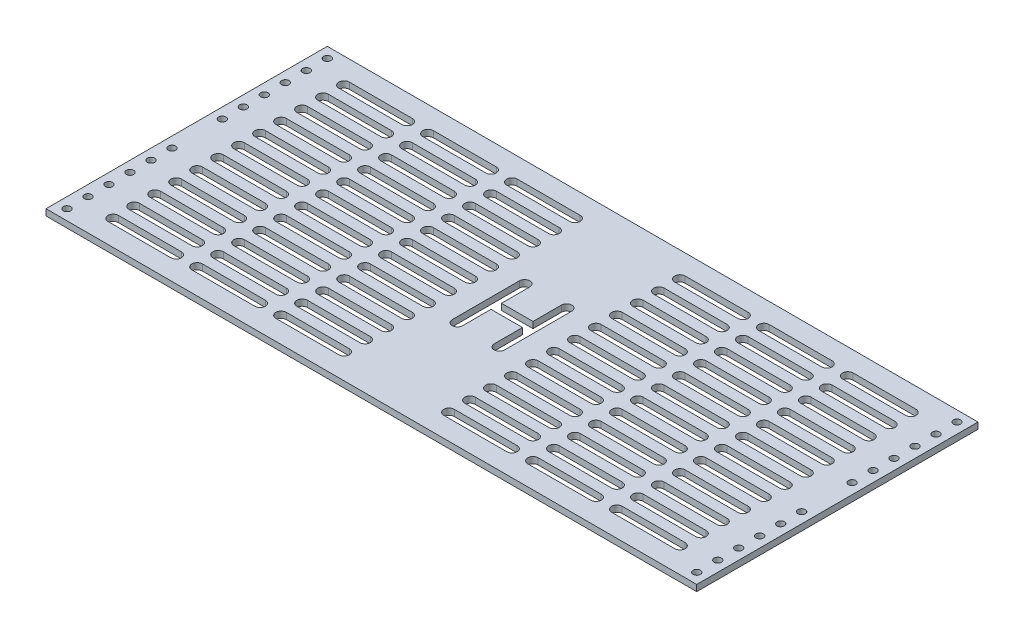
from build123d import *

# Parameters (mm, degrees)
EXTRUDE_1_DEPTH          = 3
CUT_EXTRUDE_5_DEPTH      = 10
CUT_EXTRUDE_2_DEPTH      = 205.914616365
MIRROR_2_COPY_1_DEPTH    = 205.914616365
MIRROR_2_COPY_2_DEPTH    = 205.914616365
SKETCH_4_R               = 1.75
CUT_EXTRUDE_3_DEPTH      = 205.914616365
MIRROR_4_COPY_1_SKETCH_R = 1.75
MIRROR_4_COPY_1_DEPTH    = 205.914616365
MIRROR_4_COPY_2_SKETCH_R = 1.75
MIRROR_4_COPY_2_DEPTH    = 205.914616365


with BuildPart() as part:
    # 草图1 → 凸台-拉伸1 (new body)
    with BuildSketch(Plane(origin=(0, 0, 0), x_dir=(1, 0, 0), z_dir=(0, 1, 0))):
        Polygon((0, 0), (-155, 0), (-155, -134), (155, -134), (155, 0), align=None)
    extrude(amount=EXTRUDE_1_DEPTH)

    # 草图2 → 切除-拉伸5 (cut)
    with BuildSketch(Plane(origin=(0, 3, 0), x_dir=(1, 0, 0), z_dir=(0, 1, 0))):
        with BuildLine():
            Line((7.5, -64.5), (-7.5, -64.5))
            Line((-7.5, -64.5), (-7.5, -51))
            ThreePointArc((-7.5, -51), (-10, -48.5), (-12.5, -51))
            Line((-12.5, -51), (-12.5, -83))
            ThreePointArc((-12.5, -83), (-10, -85.5), (-7.5, -83))
            Line((-7.5, -83), (-7.5, -69.5))
            Line((-7.5, -69.5), (7.5, -69.5))
            Line((7.5, -69.5), (7.5, -83))
            ThreePointArc((7.5, -83), (10, -85.5), (12.5, -83))
            Line((12.5, -83), (12.5, -51))
            ThreePointArc((12.5, -51), (10, -48.5), (7.5, -51))
            Line((7.5, -51), (7.5, -64.5))
        make_face()
    extrude(amount=-CUT_EXTRUDE_5_DEPTH, mode=Mode.SUBTRACT)

    # 草图3 → 切除-拉伸2 (cut, through all)
    with BuildSketch(Plane(origin=(0, 3, 0), x_dir=(1, 0, 0), z_dir=(0, 1, 0))):
        with BuildLine():
            ThreePointArc((-135, -119.5), (-137.5, -122), (-135, -124.5))
            Line((-135, -124.5), (-105, -124.5))
            ThreePointArc((-105, -124.5), (-102.5, -122), (-105, -119.5))
            Line((-105, -119.5), (-135, -119.5))
        make_face()
        with BuildLine():
            ThreePointArc((-55, -119.5), (-57.5, -122), (-55, -124.5))
            Line((-55, -124.5), (-25, -124.5))
            ThreePointArc((-25, -124.5), (-22.5, -122), (-25, -119.5))
            Line((-25, -119.5), (-55, -119.5))
        make_face()
        with BuildLine():
            ThreePointArc((-95, -119.5), (-97.5, -122), (-95, -124.5))
            Line((-95, -124.5), (-65, -124.5))
            ThreePointArc((-65, -124.5), (-62.5, -122), (-65, -119.5))
            Line((-65, -119.5), (-95, -119.5))
        make_face()
        with BuildLine():
            ThreePointArc((-135, -109.5), (-137.5, -112), (-135, -114.5))
            Line((-135, -114.5), (-105, -114.5))
            ThreePointArc((-105, -114.5), (-102.5, -112), (-105, -109.5))
            Line((-105, -109.5), (-135, -109.5))
        make_face()
        with BuildLine():
            ThreePointArc((-95, -109.5), (-97.5, -112), (-95, -114.5))
            Line((-95, -114.5), (-65, -114.5))
            ThreePointArc((-65, -114.5), (-62.5, -112), (-65, -109.5))
            Line((-65, -109.5), (-95, -109.5))
        make_face()
        with BuildLine():
            ThreePointArc((-55, -109.5), (-57.5, -112), (-55, -114.5))
            Line((-55, -114.5), (-25, -114.5))
            ThreePointArc((-25, -114.5), (-22.5, -112), (-25, -109.5))
            Line((-25, -109.5), (-55, -109.5))
        make_face()
        with BuildLine():
            ThreePointArc((-135, -99.5), (-137.5, -102), (-135, -104.5))
            Line((-135, -104.5), (-105, -104.5))
            ThreePointArc((-105, -104.5), (-102.5, -102), (-105, -99.5))
            Line((-105, -99.5), (-135, -99.5))
        make_face()
        with BuildLine():
            ThreePointArc((-95, -99.5), (-97.5, -102), (-95, -104.5))
            Line((-95, -104.5), (-65, -104.5))
            ThreePointArc((-65, -104.5), (-62.5, -102), (-65, -99.5))
            Line((-65, -99.5), (-95, -99.5))
        make_face()
        with BuildLine():
            ThreePointArc((-55, -99.5), (-57.5, -102), (-55, -104.5))
            Line((-55, -104.5), (-25, -104.5))
            ThreePointArc((-25, -104.5), (-22.5, -102), (-25, -99.5))
            Line((-25, -99.5), (-55, -99.5))
        make_face()
        with BuildLine():
            ThreePointArc((-135, -89.5), (-137.5, -92), (-135, -94.5))
            Line((-135, -94.5), (-105, -94.5))
            ThreePointArc((-105, -94.5), (-102.5, -92), (-105, -89.5))
            Line((-105, -89.5), (-135, -89.5))
        make_face()
        with BuildLine():
            ThreePointArc((-95, -89.5), (-97.5, -92), (-95, -94.5))
            Line((-95, -94.5), (-65, -94.5))
            ThreePointArc((-65, -94.5), (-62.5, -92), (-65, -89.5))
            Line((-65, -89.5), (-95, -89.5))
        make_face()
        with BuildLine():
            ThreePointArc((-55, -89.5), (-57.5, -92), (-55, -94.5))
            Line((-55, -94.5), (-25, -94.5))
            ThreePointArc((-25, -94.5), (-22.5, -92), (-25, -89.5))
            Line((-25, -89.5), (-55, -89.5))
        make_face()
        with BuildLine():
            ThreePointArc((-135, -79.5), (-137.5, -82), (-135, -84.5))
            Line((-135, -84.5), (-105, -84.5))
            ThreePointArc((-105, -84.5), (-102.5, -82), (-105, -79.5))
            Line((-105, -79.5), (-135, -79.5))
        make_face()
        with BuildLine():
            ThreePointArc((-95, -79.5), (-97.5, -82), (-95, -84.5))
            Line((-95, -84.5), (-65, -84.5))
            ThreePointArc((-65, -84.5), (-62.5, -82), (-65, -79.5))
            Line((-65, -79.5), (-95, -79.5))
        make_face()
        with BuildLine():
            ThreePointArc((-55, -79.5), (-57.5, -82), (-55, -84.5))
            Line((-55, -84.5), (-25, -84.5))
            ThreePointArc((-25, -84.5), (-22.5, -82), (-25, -79.5))
            Line((-25, -79.5), (-55, -79.5))
        make_face()
        with BuildLine():
            ThreePointArc((-135, -69.5), (-137.5, -72), (-135, -74.5))
            Line((-135, -74.5), (-105, -74.5))
            ThreePointArc((-105, -74.5), (-102.5, -72), (-105, -69.5))
            Line((-105, -69.5), (-135, -69.5))
        make_face()
        with BuildLine():
            ThreePointArc((-95, -69.5), (-97.5, -72), (-95, -74.5))
            Line((-95, -74.5), (-65, -74.5))
            ThreePointArc((-65, -74.5), (-62.5, -72), (-65, -69.5))
            Line((-65, -69.5), (-95, -69.5))
        make_face()
        with BuildLine():
            ThreePointArc((-55, -69.5), (-57.5, -72), (-55, -74.5))
            Line((-55, -74.5), (-25, -74.5))
            ThreePointArc((-25, -74.5), (-22.5, -72), (-25, -69.5))
            Line((-25, -69.5), (-55, -69.5))
        make_face()
    cut_extrude_2 = extrude(amount=-CUT_EXTRUDE_2_DEPTH, mode=Mode.SUBTRACT)

    # 镜向1: 切除-拉伸2 across plane
    add(cut_extrude_2.mirror(Plane.XY.offset(67)), mode=Mode.SUBTRACT)

    # 镜向2 copy 1 sketch → 镜向2 copy 1 (cut, through all)
    with BuildSketch(Plane(origin=(0, 3, 134), x_dir=(-1, 0, 0), z_dir=(0, 1, 0))):
        with BuildLine():
            ThreePointArc((-135, -119.5), (-137.5, -122), (-135, -124.5))
            Line((-135, -124.5), (-105, -124.5))
            ThreePointArc((-105, -124.5), (-102.5, -122), (-105, -119.5))
            Line((-105, -119.5), (-135, -119.5))
        make_face()
        with BuildLine():
            ThreePointArc((-55, -119.5), (-57.5, -122), (-55, -124.5))
            Line((-55, -124.5), (-25, -124.5))
            ThreePointArc((-25, -124.5), (-22.5, -122), (-25, -119.5))
            Line((-25, -119.5), (-55, -119.5))
        make_face()
        with BuildLine():
            ThreePointArc((-95, -119.5), (-97.5, -122), (-95, -124.5))
            Line((-95, -124.5), (-65, -124.5))
            ThreePointArc((-65, -124.5), (-62.5, -122), (-65, -119.5))
            Line((-65, -119.5), (-95, -119.5))
        make_face()
        with BuildLine():
            ThreePointArc((-135, -109.5), (-137.5, -112), (-135, -114.5))
            Line((-135, -114.5), (-105, -114.5))
            ThreePointArc((-105, -114.5), (-102.5, -112), (-105, -109.5))
            Line((-105, -109.5), (-135, -109.5))
        make_face()
        with BuildLine():
            ThreePointArc((-95, -109.5), (-97.5, -112), (-95, -114.5))
            Line((-95, -114.5), (-65, -114.5))
            ThreePointArc((-65, -114.5), (-62.5, -112), (-65, -109.5))
            Line((-65, -109.5), (-95, -109.5))
        make_face()
        with BuildLine():
            ThreePointArc((-55, -109.5), (-57.5, -112), (-55, -114.5))
            Line((-55, -114.5), (-25, -114.5))
            ThreePointArc((-25, -114.5), (-22.5, -112), (-25, -109.5))
            Line((-25, -109.5), (-55, -109.5))
        make_face()
        with BuildLine():
            ThreePointArc((-135, -99.5), (-137.5, -102), (-135, -104.5))
            Line((-135, -104.5), (-105, -104.5))
            ThreePointArc((-105, -104.5), (-102.5, -102), (-105, -99.5))
            Line((-105, -99.5), (-135, -99.5))
        make_face()
        with BuildLine():
            ThreePointArc((-95, -99.5), (-97.5, -102), (-95, -104.5))
            Line((-95, -104.5), (-65, -104.5))
            ThreePointArc((-65, -104.5), (-62.5, -102), (-65, -99.5))
            Line((-65, -99.5), (-95, -99.5))
        make_face()
        with BuildLine():
            ThreePointArc((-55, -99.5), (-57.5, -102), (-55, -104.5))
            Line((-55, -104.5), (-25, -104.5))
            ThreePointArc((-25, -104.5), (-22.5, -102), (-25, -99.5))
            Line((-25, -99.5), (-55, -99.5))
        make_face()
        with BuildLine():
            ThreePointArc((-135, -89.5), (-137.5, -92), (-135, -94.5))
            Line((-135, -94.5), (-105, -94.5))
            ThreePointArc((-105, -94.5), (-102.5, -92), (-105, -89.5))
            Line((-105, -89.5), (-135, -89.5))
        make_face()
        with BuildLine():
            ThreePointArc((-95, -89.5), (-97.5, -92), (-95, -94.5))
            Line((-95, -94.5), (-65, -94.5))
            ThreePointArc((-65, -94.5), (-62.5, -92), (-65, -89.5))
            Line((-65, -89.5), (-95, -89.5))
        make_face()
        with BuildLine():
            ThreePointArc((-55, -89.5), (-57.5, -92), (-55, -94.5))
            Line((-55, -94.5), (-25, -94.5))
            ThreePointArc((-25, -94.5), (-22.5, -92), (-25, -89.5))
            Line((-25, -89.5), (-55, -89.5))
        make_face()
        with BuildLine():
            ThreePointArc((-135, -79.5), (-137.5, -82), (-135, -84.5))
            Line((-135, -84.5), (-105, -84.5))
            ThreePointArc((-105, -84.5), (-102.5, -82), (-105, -79.5))
            Line((-105, -79.5), (-135, -79.5))
        make_face()
        with BuildLine():
            ThreePointArc((-95, -79.5), (-97.5, -82), (-95, -84.5))
            Line((-95, -84.5), (-65, -84.5))
            ThreePointArc((-65, -84.5), (-62.5, -82), (-65, -79.5))
            Line((-65, -79.5), (-95, -79.5))
        make_face()
        with BuildLine():
            ThreePointArc((-55, -79.5), (-57.5, -82), (-55, -84.5))
            Line((-55, -84.5), (-25, -84.5))
            ThreePointArc((-25, -84.5), (-22.5, -82), (-25, -79.5))
            Line((-25, -79.5), (-55, -79.5))
        make_face()
        with BuildLine():
            ThreePointArc((-135, -69.5), (-137.5, -72), (-135, -74.5))
            Line((-135, -74.5), (-105, -74.5))
            ThreePointArc((-105, -74.5), (-102.5, -72), (-105, -69.5))
            Line((-105, -69.5), (-135, -69.5))
        make_face()
        with BuildLine():
            ThreePointArc((-95, -69.5), (-97.5, -72), (-95, -74.5))
            Line((-95, -74.5), (-65, -74.5))
            ThreePointArc((-65, -74.5), (-62.5, -72), (-65, -69.5))
            Line((-65, -69.5), (-95, -69.5))
        make_face()
        with BuildLine():
            ThreePointArc((-55, -69.5), (-57.5, -72), (-55, -74.5))
            Line((-55, -74.5), (-25, -74.5))
            ThreePointArc((-25, -74.5), (-22.5, -72), (-25, -69.5))
            Line((-25, -69.5), (-55, -69.5))
        make_face()
    extrude(amount=-MIRROR_2_COPY_1_DEPTH, mode=Mode.SUBTRACT)

    # 镜向2 copy 2 sketch → 镜向2 copy 2 (cut, through all)
    with BuildSketch(Plane(origin=(0, 3, 0), x_dir=(-1, 0, 0), z_dir=(0, 1, 0))):
        with BuildLine():
            ThreePointArc((-135, 119.5), (-137.5, 122), (-135, 124.5))
            Line((-135, 124.5), (-105, 124.5))
            ThreePointArc((-105, 124.5), (-102.5, 122), (-105, 119.5))
            Line((-105, 119.5), (-135, 119.5))
        make_face()
        with BuildLine():
            ThreePointArc((-55, 119.5), (-57.5, 122), (-55, 124.5))
            Line((-55, 124.5), (-25, 124.5))
            ThreePointArc((-25, 124.5), (-22.5, 122), (-25, 119.5))
            Line((-25, 119.5), (-55, 119.5))
        make_face()
        with BuildLine():
            ThreePointArc((-95, 119.5), (-97.5, 122), (-95, 124.5))
            Line((-95, 124.5), (-65, 124.5))
            ThreePointArc((-65, 124.5), (-62.5, 122), (-65, 119.5))
            Line((-65, 119.5), (-95, 119.5))
        make_face()
        with BuildLine():
            ThreePointArc((-135, 109.5), (-137.5, 112), (-135, 114.5))
            Line((-135, 114.5), (-105, 114.5))
            ThreePointArc((-105, 114.5), (-102.5, 112), (-105, 109.5))
            Line((-105, 109.5), (-135, 109.5))
        make_face()
        with BuildLine():
            ThreePointArc((-95, 109.5), (-97.5, 112), (-95, 114.5))
            Line((-95, 114.5), (-65, 114.5))
            ThreePointArc((-65, 114.5), (-62.5, 112), (-65, 109.5))
            Line((-65, 109.5), (-95, 109.5))
        make_face()
        with BuildLine():
            ThreePointArc((-55, 109.5), (-57.5, 112), (-55, 114.5))
            Line((-55, 114.5), (-25, 114.5))
            ThreePointArc((-25, 114.5), (-22.5, 112), (-25, 109.5))
            Line((-25, 109.5), (-55, 109.5))
        make_face()
        with BuildLine():
            ThreePointArc((-135, 99.5), (-137.5, 102), (-135, 104.5))
            Line((-135, 104.5), (-105, 104.5))
            ThreePointArc((-105, 104.5), (-102.5, 102), (-105, 99.5))
            Line((-105, 99.5), (-135, 99.5))
        make_face()
        with BuildLine():
            ThreePointArc((-95, 99.5), (-97.5, 102), (-95, 104.5))
            Line((-95, 104.5), (-65, 104.5))
            ThreePointArc((-65, 104.5), (-62.5, 102), (-65, 99.5))
            Line((-65, 99.5), (-95, 99.5))
        make_face()
        with BuildLine():
            ThreePointArc((-55, 99.5), (-57.5, 102), (-55, 104.5))
            Line((-55, 104.5), (-25, 104.5))
            ThreePointArc((-25, 104.5), (-22.5, 102), (-25, 99.5))
            Line((-25, 99.5), (-55, 99.5))
        make_face()
        with BuildLine():
            ThreePointArc((-135, 89.5), (-137.5, 92), (-135, 94.5))
            Line((-135, 94.5), (-105, 94.5))
            ThreePointArc((-105, 94.5), (-102.5, 92), (-105, 89.5))
            Line((-105, 89.5), (-135, 89.5))
        make_face()
        with BuildLine():
            ThreePointArc((-95, 89.5), (-97.5, 92), (-95, 94.5))
            Line((-95, 94.5), (-65, 94.5))
            ThreePointArc((-65, 94.5), (-62.5, 92), (-65, 89.5))
            Line((-65, 89.5), (-95, 89.5))
        make_face()
        with BuildLine():
            ThreePointArc((-55, 89.5), (-57.5, 92), (-55, 94.5))
            Line((-55, 94.5), (-25, 94.5))
            ThreePointArc((-25, 94.5), (-22.5, 92), (-25, 89.5))
            Line((-25, 89.5), (-55, 89.5))
        make_face()
        with BuildLine():
            ThreePointArc((-135, 79.5), (-137.5, 82), (-135, 84.5))
            Line((-135, 84.5), (-105, 84.5))
            ThreePointArc((-105, 84.5), (-102.5, 82), (-105, 79.5))
            Line((-105, 79.5), (-135, 79.5))
        make_face()
        with BuildLine():
            ThreePointArc((-95, 79.5), (-97.5, 82), (-95, 84.5))
            Line((-95, 84.5), (-65, 84.5))
            ThreePointArc((-65, 84.5), (-62.5, 82), (-65, 79.5))
            Line((-65, 79.5), (-95, 79.5))
        make_face()
        with BuildLine():
            ThreePointArc((-55, 79.5), (-57.5, 82), (-55, 84.5))
            Line((-55, 84.5), (-25, 84.5))
            ThreePointArc((-25, 84.5), (-22.5, 82), (-25, 79.5))
            Line((-25, 79.5), (-55, 79.5))
        make_face()
        with BuildLine():
            ThreePointArc((-135, 69.5), (-137.5, 72), (-135, 74.5))
            Line((-135, 74.5), (-105, 74.5))
            ThreePointArc((-105, 74.5), (-102.5, 72), (-105, 69.5))
            Line((-105, 69.5), (-135, 69.5))
        make_face()
        with BuildLine():
            ThreePointArc((-95, 69.5), (-97.5, 72), (-95, 74.5))
            Line((-95, 74.5), (-65, 74.5))
            ThreePointArc((-65, 74.5), (-62.5, 72), (-65, 69.5))
            Line((-65, 69.5), (-95, 69.5))
        make_face()
        with BuildLine():
            ThreePointArc((-55, 69.5), (-57.5, 72), (-55, 74.5))
            Line((-55, 74.5), (-25, 74.5))
            ThreePointArc((-25, 74.5), (-22.5, 72), (-25, 69.5))
            Line((-25, 69.5), (-55, 69.5))
        make_face()
    extrude(amount=-MIRROR_2_COPY_2_DEPTH, mode=Mode.SUBTRACT)

    # 草图4 → 切除-拉伸3 (cut, through all)
    with BuildSketch(Plane(origin=(0, 3, 0), x_dir=(1, 0, 0), z_dir=(0, 1, 0))):
        with Locations((-150, -129)):
            Circle(SKETCH_4_R)
        with Locations((-150, -119)):
            Circle(SKETCH_4_R)
        with Locations((-150, -109)):
            Circle(SKETCH_4_R)
        with Locations((-150, -99)):
            Circle(SKETCH_4_R)
        with Locations((-150, -89)):
            Circle(SKETCH_4_R)
        with Locations((-150, -79)):
            Circle(SKETCH_4_R)
    cut_extrude_3 = extrude(amount=-CUT_EXTRUDE_3_DEPTH, mode=Mode.SUBTRACT)

    # 镜向3: 切除-拉伸3 across plane
    add(cut_extrude_3.mirror(Plane.XY.offset(67)), mode=Mode.SUBTRACT)

    # 镜向4 copy 1 sketch → 镜向4 copy 1 (cut, through all)
    with BuildSketch(Plane(origin=(0, 3, 134), x_dir=(-1, 0, 0), z_dir=(0, 1, 0))):
        with Locations((-150, -129)):
            Circle(MIRROR_4_COPY_1_SKETCH_R)
        with Locations((-150, -119)):
            Circle(MIRROR_4_COPY_1_SKETCH_R)
        with Locations((-150, -109)):
            Circle(MIRROR_4_COPY_1_SKETCH_R)
        with Locations((-150, -99)):
            Circle(MIRROR_4_COPY_1_SKETCH_R)
        with Locations((-150, -89)):
            Circle(MIRROR_4_COPY_1_SKETCH_R)
        with Locations((-150, -79)):
            Circle(MIRROR_4_COPY_1_SKETCH_R)
    extrude(amount=-MIRROR_4_COPY_1_DEPTH, mode=Mode.SUBTRACT)

    # 镜向4 copy 2 sketch → 镜向4 copy 2 (cut, through all)
    with BuildSketch(Plane(origin=(0, 3, 0), x_dir=(-1, 0, 0), z_dir=(0, 1, 0))):
        with Locations((-150, 129)):
            Circle(MIRROR_4_COPY_2_SKETCH_R)
        with Locations((-150, 119)):
            Circle(MIRROR_4_COPY_2_SKETCH_R)
        with Locations((-150, 109)):
            Circle(MIRROR_4_COPY_2_SKETCH_R)
        with Locations((-150, 99)):
            Circle(MIRROR_4_COPY_2_SKETCH_R)
        with Locations((-150, 89)):
            Circle(MIRROR_4_COPY_2_SKETCH_R)
        with Locations((-150, 79)):
            Circle(MIRROR_4_COPY_2_SKETCH_R)
    extrude(amount=-MIRROR_4_COPY_2_DEPTH, mode=Mode.SUBTRACT)


solid = part.part
